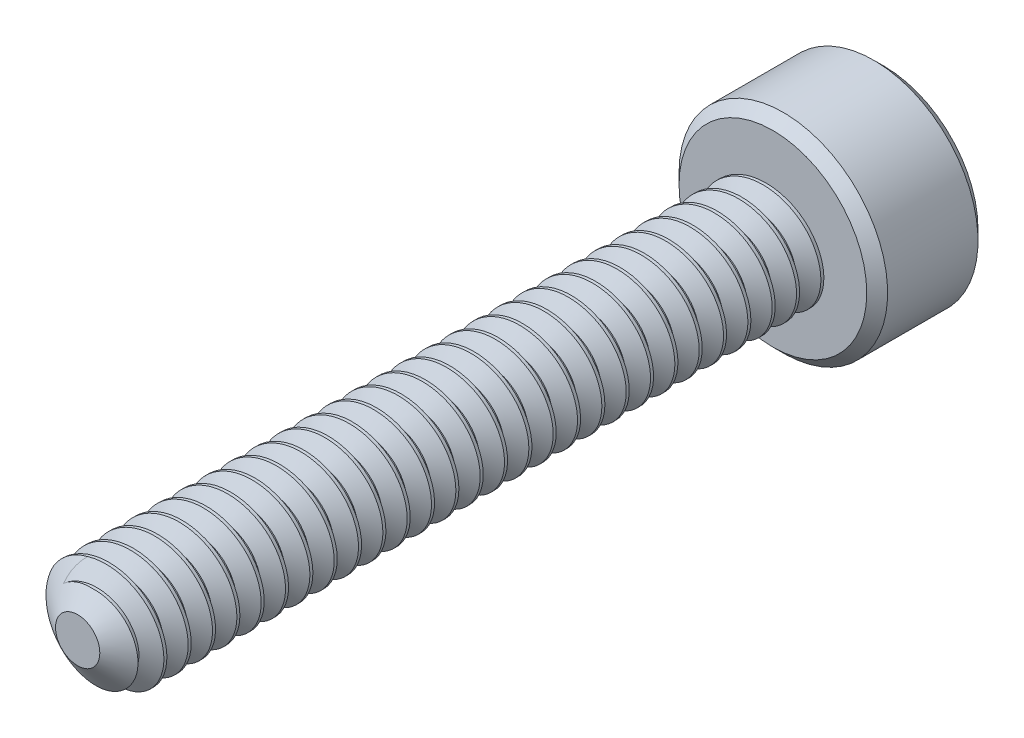
from build123d import *

# Parameters (mm, degrees)
SKETCH1_R          = 0.8
EXTRUDE1_DEPTH     = 10
CUT_SWEEP1_PITCH   = 0.35
SKETCH6_R          = 1.5
EXTRUDE2_DEPTH     = 1.6
CUT_EXTRUDE1_DEPTH = 1.125
CHAMFER1_SIZE      = 0.15


with BuildPart() as part:
    # Sketch1 → Extrude1 (new body)
    with BuildSketch(Plane.XY):
        Circle(SKETCH1_R)
    extrude(amount=-EXTRUDE1_DEPTH)

    # Cut-Sweep1: arcs per turn and ends read off the stored shape
    # Cut-Sweep1: the profile of Sketch3 profile screwed along a right-hand helix through 31 turns, 6 arcs to a turn; built about Z, then put on its axis
    cut_sweep1_z = Axis((0, 0, 0), (0, 0, 1))
    cut_sweep1_corners = [(0.8003, 0, -0.656423205), (0.572668332, 0, -0.525), (0.572668332, 0, -0.48125), (0.8003, 0, -0.349826795)]
    with BuildLine(mode=Mode.PRIVATE) as cut_sweep1_profile:
        Line(cut_sweep1_corners[0], cut_sweep1_corners[1])
        Line(cut_sweep1_corners[1], cut_sweep1_corners[2])
        Line(cut_sweep1_corners[2], cut_sweep1_corners[3])
        Line(cut_sweep1_corners[3], cut_sweep1_corners[0])
    cut_sweep1_cap = Face(cut_sweep1_profile.wire())
    cut_sweep1_turn_angles = [0, 30, 60, 90, 120, 150, 180, 210, 240, 270, 300, 330, 360]
    cut_sweep1_turn_weights = [1, 0.8660254037844387, 1, 0.8660254037844387, 1, 0.8660254037844387, 1, 0.8660254037844387, 1, 0.8660254037844387, 1, 0.8660254037844387, 1]
    cut_sweep1_turn_rails = [Edge.make_bspline([Vector(p[0], p[1], 0).rotate(cut_sweep1_z, cut_sweep1_turn_angles[k]) / cut_sweep1_turn_weights[k] + Vector(0, 0, p[2] + CUT_SWEEP1_PITCH * cut_sweep1_turn_angles[k] / 360) for k in range(13)], [0, 0, 0, 1, 1, 2, 2, 3, 3, 4, 4, 5, 5, 6, 6, 6], 2, cut_sweep1_turn_weights) for p in cut_sweep1_corners]
    cut_sweep1_turn_sides = [Face.make_surface_from_curves(cut_sweep1_turn_rails[p[0]], cut_sweep1_turn_rails[p[1]]) for p in [(0, 1), (1, 2), (2, 3), (3, 0)]]
    cut_sweep1 = Plane(origin=(0, 0, 0), x_dir=(0, 1, 0), z_dir=(0, 0, -1)) * Solid(Shell([*[p.moved(Location((0, 0, CUT_SWEEP1_PITCH * i))) for i in range(31) for p in cut_sweep1_turn_sides], cut_sweep1_cap, cut_sweep1_cap.rotate(cut_sweep1_z, 11160).moved(Location((0, 0, CUT_SWEEP1_PITCH * 11160 / 360)))]))
    add(cut_sweep1, mode=Mode.SUBTRACT)

    # Sketch4 → Cut-Revolve1 (revolve, cut)
    with BuildSketch(Plane(origin=(0, 0, 0), x_dir=(0, 0, -1), z_dir=(1, 0, 0)), mode=Mode.PRIVATE) as cut_revolve1_sk:
        Polygon((0.337032063, 0.8), (0, 0.318668332), (0, 0.8), align=None)
    revolve(cut_revolve1_sk.sketch.rotate(Axis((0, 0, 0), (0, 0, -1)), 301.815814274), axis=Axis((0, 0, 0), (0, 0, -1)), mode=Mode.SUBTRACT)

    # Sketch6 → Extrude2 (add)
    with BuildSketch(Plane(origin=(0, 0, -10), x_dir=(-1, 0, 0), z_dir=(0, 0, -1))):
        Circle(SKETCH6_R)
    extrude(amount=EXTRUDE2_DEPTH)

    # Sketch7 → Cut-Extrude1 (cut)
    with BuildSketch(Plane(origin=(0, 0, -11.6), x_dir=(-1, 0, 0), z_dir=(0, 0, -1))):
        Polygon((0, 0.866025404), (-0.75, 0.433012702), (-0.75, -0.433012702), (0, -0.866025404), (0.75, -0.433012702), (0.75, 0.433012702), align=None)
    extrude(amount=-CUT_EXTRUDE1_DEPTH, mode=Mode.SUBTRACT)

    # Cut-Extrude2 cone 1 section (through the dimple's axis) → Cut-Extrude2 (revolve, cut)
    with BuildSketch(Plane(origin=(0, 0, -11.6), x_dir=(0, 1, 0), z_dir=(1, 0, 0))):
        Polygon((0, 0), (0.866025404, 0), (0, 0.866025404), align=None)
    revolve(axis=Axis((0, 0, -11.6), (0, 0, 1)), mode=Mode.SUBTRACT)

    # Chamfer1
    chamfer1_edges = [part.edges().sort_by_distance(p)[0] for p in [
        (1.5, 0, -10),
        (1.5, 0, -11.6),
    ]]
    chamfer(chamfer1_edges, length=CHAMFER1_SIZE)


solid = part.part
